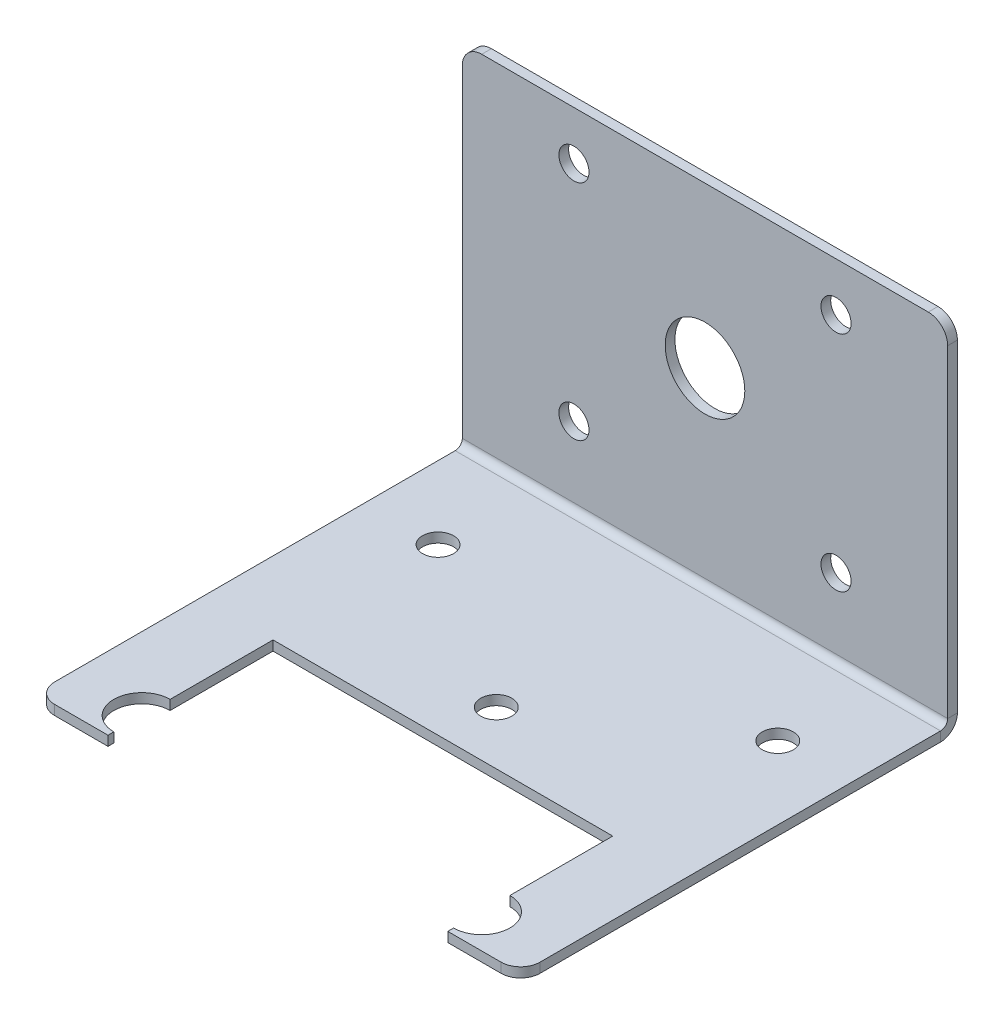
from build123d import *

# Parameters (mm, degrees)
SM_BASE_FLANGE_1_DEPTH           = 1
SM_EDGE_FLANGE_2_STRIP_W         = 5.4732
SM_EDGE_FLANGE_2_STRIP_H         = 1
SM_EDGE_FLANGE_2_STRIP_CUT_DEPTH = 50
SM_EDGE_FLANGE_2_DEPTH           = 50
SKETCH_10_R                      = 1.55
SKETCH_10_R_2                    = 4.1
CUT_EXTRUDE_7_DEPTH              = 10
CUT_EXTRUDE_6_REACH              = 51.267
SKETCH_19_R                      = 2.9
SKETCH_19_R_2                    = 1.6
FILLET_2_R                       = 2


# Sheet-metal steps are written as plain solids
with BuildPart() as part:
    # Sketch 2 → 基体-法兰1 (new body)
    with BuildSketch(Plane(origin=(0, 0, 0), x_dir=(1, 0, 0), z_dir=(0, 1, 0))):
        Polygon((-17.5, -5.5), (17.5, -5.5), (17.5, -22.5), (25, -22.5), (25, 22.5), (-25, 22.5), (-25, -22.5), (-17.5, -22.5), align=None)
    extrude(amount=-SM_BASE_FLANGE_1_DEPTH)

    # 边线-法兰2 strip (across the edge) → 边线-法兰2 strip cut (cut)
    with BuildSketch(Plane(origin=(25, 0, -22.5), x_dir=(0, 0, 1), z_dir=(-1, 0, 0))):
        with Locations((-1, -0.5)):
            Rectangle(SM_EDGE_FLANGE_2_STRIP_W, SM_EDGE_FLANGE_2_STRIP_H)
    extrude(amount=SM_EDGE_FLANGE_2_STRIP_CUT_DEPTH, mode=Mode.SUBTRACT)

    # 边线-法兰2 section (across the edge) → 边线-法兰2 (add)
    with BuildSketch(Plane(origin=(25, 0, -22.5), x_dir=(0, 0, 1), z_dir=(-1, 0, 0))):
        with BuildLine():
            Line((0, 0.7366), (0, 36))
            Line((0, 36), (1, 36))
            Line((1, 36), (1, 0.7366))
            ThreePointArc((1, 0.7366), (1.215745145, 0.215745145), (1.7366, 0))
            Line((1.7366, 0), (1.7366, -1))
            ThreePointArc((1.7366, -1), (0.508638364, -0.491361636), (0, 0.7366))
        make_face()
    extrude(amount=SM_EDGE_FLANGE_2_DEPTH)

    # 草图10 → 切除-拉伸7 (cut)
    with BuildSketch(Plane.XY.offset(-21.5)):
        with Locations((-13.5, 31)):
            Circle(SKETCH_10_R)
        with Locations((13.5, 31)):
            Circle(SKETCH_10_R)
        with Locations((13.5, 8)):
            Circle(SKETCH_10_R)
        with Locations((-13.5, 8)):
            Circle(SKETCH_10_R)
        with Locations((0, 19.5)):
            Circle(SKETCH_10_R_2)
    extrude(amount=-CUT_EXTRUDE_7_DEPTH, mode=Mode.SUBTRACT)

    # 草图19 → 切除-拉伸6 (cut, up to next)
    with BuildSketch(Plane(origin=(0, 0, 0), x_dir=(1, 0, 0), z_dir=(0, 1, 0)), mode=Mode.PRIVATE) as cut_extrude_6_sk1:
        with Locations((-17.5, -19)):
            Circle(SKETCH_19_R)
    cut_extrude_6_tool1 = extrude(cut_extrude_6_sk1.sketch, amount=-CUT_EXTRUDE_6_REACH, mode=Mode.PRIVATE) & part.part
    # 草图19 → 切除-拉伸6 (cut, up to next)
    with BuildSketch(Plane(origin=(0, 0, 0), x_dir=(1, 0, 0), z_dir=(0, 1, 0)), mode=Mode.PRIVATE) as cut_extrude_6_sk2:
        with Locations((17.5, -19)):
            Circle(SKETCH_19_R)
    cut_extrude_6_tool2 = extrude(cut_extrude_6_sk2.sketch, amount=-CUT_EXTRUDE_6_REACH, mode=Mode.PRIVATE) & part.part
    # 草图19 → 切除-拉伸6 (cut, up to next)
    with BuildSketch(Plane(origin=(0, 0, 0), x_dir=(1, 0, 0), z_dir=(0, 1, 0)), mode=Mode.PRIVATE) as cut_extrude_6_sk3:
        with Locations(Location((-17.5, 11.5, 0), (0, 0, 270))):
            Circle(SKETCH_19_R_2)
    cut_extrude_6_tool3 = extrude(cut_extrude_6_sk3.sketch, amount=-CUT_EXTRUDE_6_REACH, mode=Mode.PRIVATE) & part.part
    # 草图19 → 切除-拉伸6 (cut, up to next)
    with BuildSketch(Plane(origin=(0, 0, 0), x_dir=(1, 0, 0), z_dir=(0, 1, 0)), mode=Mode.PRIVATE) as cut_extrude_6_sk4:
        with Locations(Location((17.5, 11.5, 0), (0, 0, 90))):
            Circle(SKETCH_19_R_2)
    cut_extrude_6_tool4 = extrude(cut_extrude_6_sk4.sketch, amount=-CUT_EXTRUDE_6_REACH, mode=Mode.PRIVATE) & part.part
    # 草图19 → 切除-拉伸6 (cut, up to next)
    with BuildSketch(Plane(origin=(0, 0, 0), x_dir=(1, 0, 0), z_dir=(0, 1, 0)), mode=Mode.PRIVATE) as cut_extrude_6_sk5:
        with Locations(Location((0, 0, 0), (0, 0, 270))):
            Circle(SKETCH_19_R_2)
    cut_extrude_6_tool5 = extrude(cut_extrude_6_sk5.sketch, amount=-CUT_EXTRUDE_6_REACH, mode=Mode.PRIVATE) & part.part
    add(cut_extrude_6_tool1.solids().sort_by_distance((-17.5, 0, 19))[0], mode=Mode.SUBTRACT)
    add(cut_extrude_6_tool2.solids().sort_by_distance((17.5, 0, 19))[0], mode=Mode.SUBTRACT)
    add(cut_extrude_6_tool3.solids().sort_by_distance((-17.5, 0, -11.5))[0], mode=Mode.SUBTRACT)
    add(cut_extrude_6_tool4.solids().sort_by_distance((17.5, 0, -11.5))[0], mode=Mode.SUBTRACT)
    add(cut_extrude_6_tool5.solids().sort_by_distance((0, 0, 0))[0], mode=Mode.SUBTRACT)

    # 圆角2
    fillet_2_edges = [part.edges().sort_by_distance(p)[0] for p in [
        (-25, -0.5, 22.5),
        (25, -0.5, 22.5),
        (25, 36, -22),
        (-25, 36, -22),
    ]]
    fillet(fillet_2_edges, radius=FILLET_2_R)


solid = part.part
